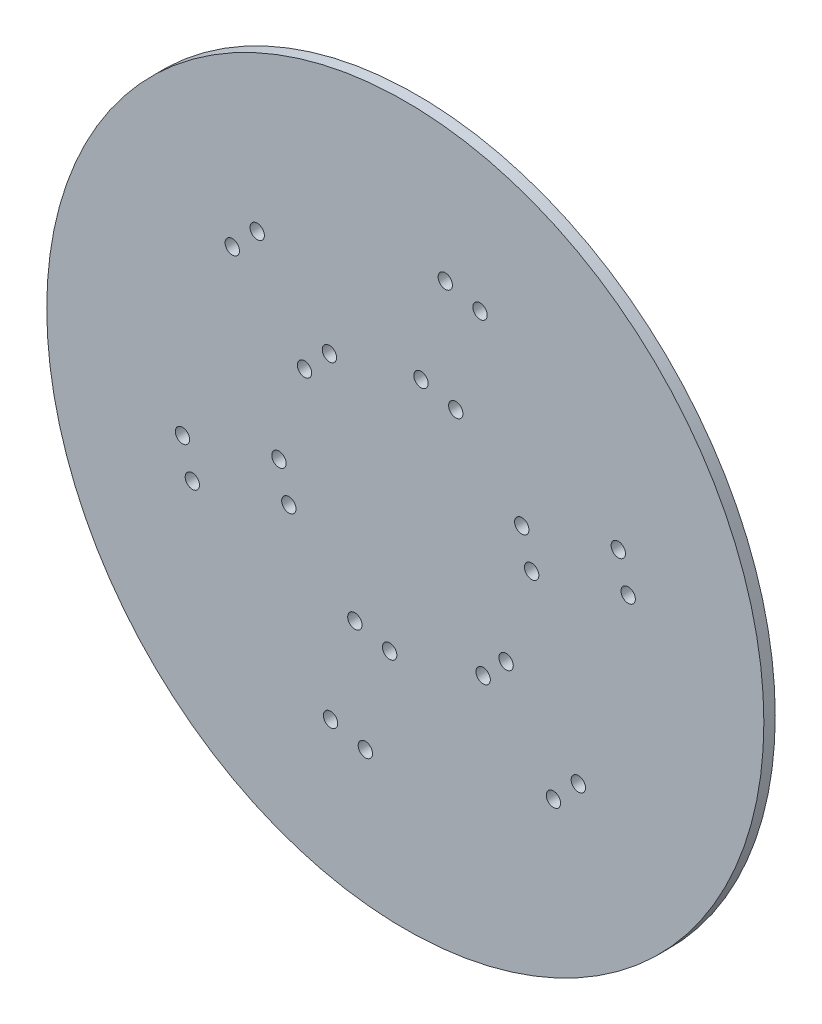
from build123d import *

# Parameters (mm, degrees)
SKETCH1_R           = 100
BOSS_EXTRUDE1_DEPTH = 3.175
SKETCH6_R           = 2
CUT_EXTRUDE1_DEPTH  = 142.456992139


with BuildPart() as part:
    # Sketch1 → Boss-Extrude1 (new body)
    with BuildSketch(Plane.XY):
        Circle(SKETCH1_R)
    extrude(amount=BOSS_EXTRUDE1_DEPTH)

    # Sketch6 → Cut-Extrude1 (cut, through all)
    with BuildSketch(Plane.XY.offset(3.175)):
        with Locations((-11.142458236, -62.1504603)):
            Circle(SKETCH6_R)
        with Locations((-20.84545523, -59.731400704)):
            Circle(SKETCH6_R)
        with Locations((-4.369091369, -34.982068715)):
            Circle(SKETCH6_R)
        with Locations((-14.072088363, -32.56300912)):
            Circle(SKETCH6_R)
        with Locations((48.252648358, -40.724882042)):
            Circle(SKETCH6_R)
        with Locations((41.306182798, -47.918394135)):
            Circle(SKETCH6_R)
        with Locations((21.706133595, -27.876828536)):
            Circle(SKETCH6_R)
        with Locations((28.1108145, -21.274778474)):
            Circle(SKETCH6_R)
        with Locations((62.151638028, 11.813006569)):
            Circle(SKETCH6_R)
        with Locations((59.395106594, 21.425578257)):
            Circle(SKETCH6_R)
        with Locations((32.479905868, 13.707290241)):
            Circle(SKETCH6_R)
        with Locations((35.236437303, 4.094718553)):
            Circle(SKETCH6_R)
        with Locations((20.84545523, 59.731400704)):
            Circle(SKETCH6_R)
        with Locations((11.142458236, 62.1504603)):
            Circle(SKETCH6_R)
        with Locations((4.369091369, 34.982068715)):
            Circle(SKETCH6_R)
        with Locations((14.072088363, 32.56300912)):
            Circle(SKETCH6_R)
        with Locations((-21.16434894, 28.468290567)):
            Circle(SKETCH6_R)
        with Locations((-28.1108145, 21.274778474)):
            Circle(SKETCH6_R)
        with Locations((-48.252648358, 40.724882042)):
            Circle(SKETCH6_R)
        with Locations((-41.306182798, 47.918394135)):
            Circle(SKETCH6_R)
        with Locations((-32.479905868, -13.707290241)):
            Circle(SKETCH6_R)
        with Locations((-35.236437303, -4.094718553)):
            Circle(SKETCH6_R)
        with Locations((-59.395106594, -21.425578257)):
            Circle(SKETCH6_R)
        with Locations((-62.151638028, -11.813006569)):
            Circle(SKETCH6_R)
    extrude(amount=-CUT_EXTRUDE1_DEPTH, mode=Mode.SUBTRACT)


solid = part.part
